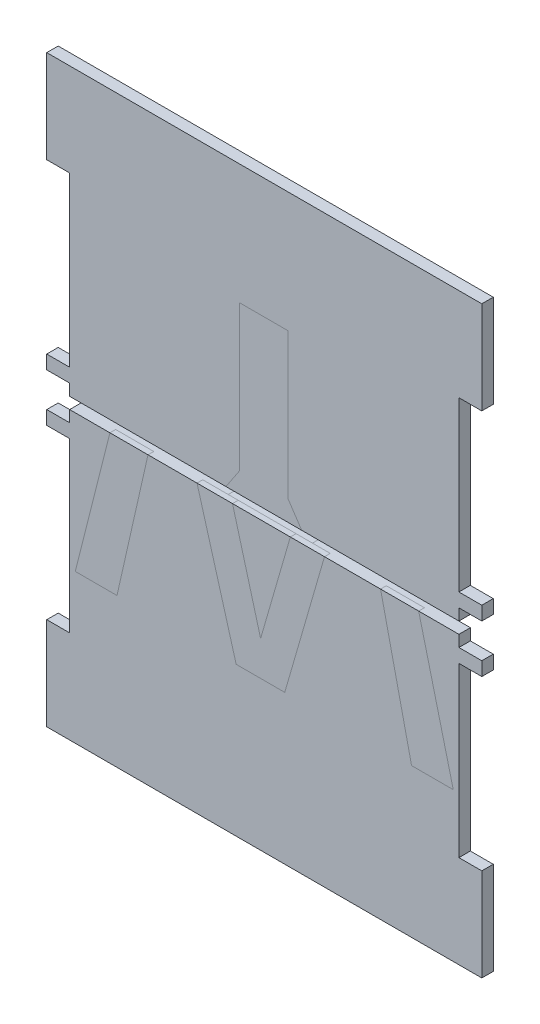
from build123d import *

# Parameters (mm, degrees)
FLIPS_DEPTH             = 1
FLIPS_2_DEPTH           = 1
FRONT_CUT_START         = -0.5
FRONT_CUT_DEPTH         = 0.5
FRONT_CUT_2_DEPTH       = 0.5
FRONT_EXTRUDE_START     = -0.5
FRONT_EXTRUDE_DEPTH     = 0.5
NEXT_CUT_DEPTH          = 0.5
NEXT_EXTRUDE_START      = 0.5
NEXT_EXTRUDE_DEPTH      = 0.5
CLEANUP_CUT_START       = 0.5
CLEANUP_CUT_DEPTH       = 0.5
CLEANUP_CUT_2_DEPTH     = 0.5
CLEANUP_CUT_START_2     = -15
CLEANUP_CUT_3_OUTLINE_W = 30
CLEANUP_CUT_3_OUTLINE_H = 0.5
CLEANUP_CUT_3_DEPTH     = 15.5
CLEANUP_CUT_START_3     = -0.5
CLEANUP_CUT_4_OUTLINE_W = 11
CLEANUP_CUT_4_OUTLINE_H = 0.5
CLEANUP_CUT_4_DEPTH     = 15.5
PREV_CUT_DEPTH          = 0.5
PREV_EXTRUDE_DEPTH      = 0.5
CLEANUP_CUT2_DEPTH      = 32.815876683
CLEANUP_CUT2_DEPTH_BACK = 32.815876683
FRONT_CHAR_5_OUTSIDE_W  = 52.722
FRONT_CHAR_5_OUTSIDE_H  = 65.722


with BuildPart() as part:
    # Front_Char → Flips (new body)
    with BuildSketch(Plane.XY):
        Polygon((19, 1.5), (19, 2.7), (17, 2.7), (17, 17.394721707), (19, 17.394721707), (19, 25.5), (-19, 25.5), (-19, 17.394721707), (-17, 17.394721707), (-17, 2.7), (-19, 2.7), (-19, 1.5), (-17, 1.5), (-17, 0.5), (17, 0.5), (17, 1.5), align=None)
    extrude(amount=FLIPS_DEPTH)

    # Front_Cut 2 outline → Front_Cut 2 (cut)
    with BuildSketch(Plane(origin=(0, 0, 0), x_dir=(-1, 0, 0), z_dir=(0, 0, -1)).offset(FRONT_CUT_START)):
        with BuildLine():
            add(Edge.make_bspline(
                [(-1.796875, 7.403846154), (-1.668358724, 7.213760088), (-1.427193674, 6.857057286), (-1.091948313, 6.351098385), (-0.81895366, 5.902065857), (-0.59073302, 5.516459789), (-0.424619237, 5.187987694), (-0.303286719, 4.92271251), (-0.241039558, 4.712483045), (-0.240571503, 4.591554361), (-0.240384615, 4.543269231)],
                knots=[0, 0, 0, 0, 0.209538372, 0.393205699, 0.554151123, 0.689381787, 0.802279615, 0.88995155, 0.956059195, 1, 1, 1, 1], degree=3))
            Line((-1.796875, 7.403846154), (-7.03125, 15))
            Line((-7.03125, 15), (-12.127403846, 15))
            Line((-12.127403846, 15), (-2.578125, 1.141826923))
            Line((-2.578125, 1.141826923), (-3.018992711, 0.5))
            Line((-3.018992711, 0.5), (2.963148805, 0.5))
            Line((2.963148805, 0.5), (2.554086538, 1.09375))
            Line((2.554086538, 1.09375), (12.103365385, 15))
            Line((12.103365385, 15), (6.935096154, 15))
            Line((6.935096154, 15), (1.71875, 7.397836538))
            add(Edge.make_bspline(
                [(-0.240384615, 4.543269231), (-0.112073047, 4.729494248), (0.169135601, 5.137626465), (0.622821442, 5.801402262), (1.147074806, 6.56702918), (1.520315923, 7.109455141), (1.71875, 7.397836538)],
                knots=[0, 0, 0, 0, 0.195959094, 0.429465498, 0.696674664, 1, 1, 1, 1], degree=3))
        make_face()
    extrude(amount=FRONT_CUT_2_DEPTH, mode=Mode.SUBTRACT)

    # Next_Char → Next_Cut (cut)
    with BuildSketch(Plane.XY.offset(1)):
        with BuildLine():
            Line((2.073317308, 15), (2.073317308, 2.289663462))
            Line((2.073317308, 2.289663462), (13.611778846, -15))
            Line((13.611778846, -15), (8.605769231, -15))
            Line((8.605769231, -15), (2.788461538, -5.829326923))
            add(Edge.make_bspline(
                [(2.788461538, -5.829326923), (2.527139066, -5.421248007), (2.020648394, -4.630316548), (1.29915823, -3.471049535), (0.601160811, -2.399532249), (0.163329239, -1.701315402), (-0.048076923, -1.364182692)],
                knots=[0, 0, 0, 0, 1.099235052, 2.130518266, 3.097324212, 4, 4, 4, 4], degree=3))
            add(Edge.make_bspline(
                [(-0.048076923, -1.364182692), (-0.261127879, -1.696263627), (-0.715771827, -2.404913753), (-1.42586903, -3.545743348), (-2.242751863, -4.808410274), (-2.805506862, -5.702476855), (-3.100961538, -6.171875)],
                knots=[0, 0, 0, 0, 0.831333946, 1.774040134, 2.831338233, 4, 4, 4, 4], degree=3))
            Line((-3.100961538, -6.171875), (-8.689903846, -15))
            Line((-8.689903846, -15), (-13.695913462, -15))
            Line((-13.695913462, -15), (-2.157451923, 2.289663462))
            Line((-2.157451923, 2.289663462), (-2.157451923, 15))
            Line((-2.157451923, 15), (2.073317308, 15))
        make_face()
    extrude(amount=-NEXT_CUT_DEPTH, mode=Mode.SUBTRACT)


with BuildPart() as body_2:
    # Front_Char → Flips 2 (new body)
    with BuildSketch(Plane.XY):
        Polygon((17, -0.5), (17, -1.5), (19, -1.5), (19, -2.7), (17, -2.7), (17, -17.394721707), (19, -17.394721707), (19, -25.5), (-19, -25.5), (-19, -17.394721707), (-17, -17.394721707), (-17, -2.7), (-19, -2.7), (-19, -1.5), (-17, -1.5), (-17, -0.5), align=None)
    extrude(amount=FLIPS_2_DEPTH)

    # Front_Cut: read off the stored shape, not the designer's step
    # Front_Cut outline → Front_Cut (cut)
    with BuildSketch(Plane(origin=(0, 0, 0), x_dir=(-1, 0, 0), z_dir=(0, 0, -1)).offset(FRONT_CUT_START)):
        with BuildLine():
            add(Edge.make_bspline(
                [(1.237980769, -4.399038462), (1.02932484, -4.098780348), (0.616783507, -3.505128955), (0.20802532, -2.908866437), (0.006009615, -2.614182692)],
                knots=[0, 0, 0, 0, 0.505781874, 1, 1, 1, 1], degree=3))
            Line((1.237980769, -4.399038462), (8.539663462, -15))
            Line((8.539663462, -15), (13.641826923, -15))
            Line((13.641826923, -15), (3.65209578, -0.5))
            Line((3.65209578, -0.5), (-3.705887723, -0.5))
            Line((-3.705887723, -0.5), (-13.665865385, -15))
            Line((-13.665865385, -15), (-8.503605769, -15))
            Line((-8.503605769, -15), (-1.40625, -4.675480769))
            add(Edge.make_bspline(
                [(0.006009615, -2.614182692), (-0.147818769, -2.838828558), (-0.43099404, -3.252368321), (-0.825162113, -3.815479877), (-1.1362099, -4.281944613), (-1.323884664, -4.555447717), (-1.40625, -4.675480769)],
                knots=[0, 0, 0, 0, 0.326889026, 0.601754279, 0.825220815, 1, 1, 1, 1], degree=3))
        make_face()
    extrude(amount=FRONT_CUT_DEPTH, mode=Mode.SUBTRACT)

    # Prev_Char → Prev_Cut (cut)
    with BuildSketch(Plane.XY.offset(1)):
        with BuildLine():
            Line((10.211338141, 12.5), (16.506410256, -12.5))
            Line((16.506410256, -12.5), (12.865584936, -12.5))
            Line((12.865584936, -12.5), (9.154647436, 3.94130609))
            add(Edge.make_bspline(
                [(9.154647436, 3.94130609), (8.962323574, 4.789250655), (8.579639319, 6.476482969), (8.201112736, 8.1646529), (8.012820513, 9.004407051)],
                knots=[0, 0, 0, 0, 1.00513078, 2, 2, 2, 2], degree=3))
            add(Edge.make_bspline(
                [(8.012820513, 9.004407051), (7.923670053, 8.702452242), (7.75537023, 8.132416585), (7.527861486, 7.324336111), (7.321222583, 6.619065942), (7.145176842, 6.013318214), (7.002633286, 5.506241888), (6.8795628, 5.104067894), (6.795679493, 4.79892035), (6.745970094, 4.630691497), (6.725761218, 4.562299679)],
                knots=[0, 0, 0, 0, 1.633809233, 3.084334118, 4.356383392, 5.447555203, 6.357852567, 7.089694452, 7.629924063, 8, 8, 8, 8], degree=3))
            Line((6.725761218, 4.562299679), (1.787860577, -12.5))
            Line((1.787860577, -12.5), (-2.453926282, -12.5))
            Line((-2.453926282, -12.5), (-6.024639423, 0.025040064))
            add(Edge.make_bspline(
                [(-6.024639423, 0.025040064), (-6.221693067, 0.798787916), (-6.610240205, 2.324451225), (-7.126487791, 4.596983239), (-7.602967814, 6.814383167), (-7.877429254, 8.280951792), (-8.012820513, 9.004407051)],
                knots=[0, 0, 0, 0, 1.04154457, 2.053700482, 3.039894486, 4, 4, 4, 4], degree=3))
            add(Edge.make_bspline(
                [(-8.012820513, 9.004407051), (-8.096609752, 8.63555597), (-8.273613413, 7.856362934), (-8.545813732, 6.62662536), (-8.8547496, 5.277284142), (-9.064942079, 4.337038053), (-9.174679487, 3.846153846)],
                knots=[0, 0, 0, 0, 0.858436457, 1.813435672, 2.858437265, 4, 4, 4, 4], degree=3))
            Line((-9.174679487, 3.846153846), (-12.865584936, -12.5))
            Line((-12.865584936, -12.5), (-16.506410256, -12.5))
            Line((-16.506410256, -12.5), (-10.206330128, 12.5))
            Line((-10.206330128, 12.5), (-6.330128205, 12.5))
            Line((-6.330128205, 12.5), (-1.106770833, -6.60556891))
            add(Edge.make_bspline(
                [(-1.106770833, -6.60556891), (-1.054320801, -6.792343603), (-0.954685271, -7.14714597), (-0.824086426, -7.653460973), (-0.694575493, -8.098744187), (-0.591562317, -8.488750166), (-0.502413038, -8.819548863), (-0.423467538, -9.090171754), (-0.372691915, -9.305915362), (-0.335973343, -9.428537611), (-0.320512821, -9.480168269)],
                knots=[0, 0, 0, 0, 1.562239628, 2.967673567, 4.210417925, 5.296319877, 6.215971374, 6.969386481, 7.566055473, 8, 8, 8, 8], degree=3))
            add(Edge.make_bspline(
                [(-0.320512821, -9.480168269), (-0.227569577, -9.152822274), (-0.051514878, -8.532757829), (0.204879934, -7.660944314), (0.425315183, -6.895927635), (0.562495622, -6.423590497), (0.626001603, -6.204927885)],
                knots=[0, 0, 0, 0, 1.197732026, 2.268764715, 3.198546125, 4, 4, 4, 4], degree=3))
            Line((0.626001603, -6.204927885), (6.039663462, 12.5))
            Line((6.039663462, 12.5), (10.211338141, 12.5))
        make_face()
    extrude(amount=-PREV_CUT_DEPTH, mode=Mode.SUBTRACT)


with BuildPart() as body_3:
    # Front_Extrude: read off the stored shape, not the designer's step
    # Front_Extrude outline → Front_Extrude (new body)
    with BuildSketch(Plane(origin=(0, 0, 0), x_dir=(-1, 0, 0), z_dir=(0, 0, -1)).offset(FRONT_EXTRUDE_START)):
        with BuildLine():
            Line((-13.665865385, -15), (-8.503605769, -15))
            Line((-8.503605769, -15), (-1.40625, -4.675480769))
            add(Edge.make_bspline(
                [(0.006009615, -2.614182692), (-0.147818769, -2.838828558), (-0.43099404, -3.252368321), (-0.825162113, -3.815479877), (-1.1362099, -4.281944613), (-1.323884664, -4.555447717), (-1.40625, -4.675480769)],
                knots=[0, 0, 0, 0, 0.326889026, 0.601754279, 0.825220815, 1, 1, 1, 1], degree=3))
            add(Edge.make_bspline(
                [(1.237980769, -4.399038462), (1.02932484, -4.098780348), (0.616783507, -3.505128955), (0.20802532, -2.908866437), (0.006009615, -2.614182692)],
                knots=[0, 0, 0, 0, 0.505781874, 1, 1, 1, 1], degree=3))
            Line((1.237980769, -4.399038462), (8.539663462, -15))
            Line((8.539663462, -15), (13.641826923, -15))
            Line((13.641826923, -15), (2.554086538, 1.09375))
            Line((2.554086538, 1.09375), (12.103365385, 15))
            Line((12.103365385, 15), (6.935096154, 15))
            Line((6.935096154, 15), (1.71875, 7.397836538))
            add(Edge.make_bspline(
                [(-0.240384615, 4.543269231), (-0.112073047, 4.729494248), (0.169135601, 5.137626465), (0.622821442, 5.801402262), (1.147074806, 6.56702918), (1.520315923, 7.109455141), (1.71875, 7.397836538)],
                knots=[0, 0, 0, 0, 0.195959094, 0.429465498, 0.696674664, 1, 1, 1, 1], degree=3))
            add(Edge.make_bspline(
                [(-1.796875, 7.403846154), (-1.668358724, 7.213760088), (-1.427193674, 6.857057286), (-1.091948313, 6.351098385), (-0.81895366, 5.902065857), (-0.59073302, 5.516459789), (-0.424619237, 5.187987694), (-0.303286719, 4.92271251), (-0.241039558, 4.712483045), (-0.240571503, 4.591554361), (-0.240384615, 4.543269231)],
                knots=[0, 0, 0, 0, 0.209538372, 0.393205699, 0.554151123, 0.689381787, 0.802279615, 0.88995155, 0.956059195, 1, 1, 1, 1], degree=3))
            Line((-1.796875, 7.403846154), (-7.03125, 15))
            Line((-7.03125, 15), (-12.127403846, 15))
            Line((-12.127403846, 15), (-2.578125, 1.141826923))
            Line((-2.578125, 1.141826923), (-13.665865385, -15))
        make_face()
    extrude(amount=FRONT_EXTRUDE_DEPTH)

    # CleanUp_Cut 3 outline → CleanUp_Cut 3 (cut)
    with BuildSketch(Plane(origin=(0, 0, 0), x_dir=(1, 0, 0), z_dir=(0, 1, 0)).offset(CLEANUP_CUT_START_2)):
        with Locations((0, -0.25)):
            Rectangle(CLEANUP_CUT_3_OUTLINE_W, CLEANUP_CUT_3_OUTLINE_H)
    extrude(amount=CLEANUP_CUT_3_DEPTH, mode=Mode.SUBTRACT)


with BuildPart() as body_4:
    # Next_Extrude: read off the stored shape, not the designer's step
    # Next_Extrude outline → Next_Extrude (new body)
    with BuildSketch(Plane.XY.offset(NEXT_EXTRUDE_START)):
        with BuildLine():
            Line((2.073317308, 15), (-2.157451923, 15))
            Line((-2.157451923, 15), (-2.157451923, 2.289663462))
            Line((-2.157451923, 2.289663462), (-13.695913462, -15))
            Line((-13.695913462, -15), (-8.689903846, -15))
            Line((-8.689903846, -15), (-3.100961538, -6.171875))
            add(Edge.make_bspline(
                [(-0.048076923, -1.364182692), (-0.261127879, -1.696263627), (-0.715771827, -2.404913753), (-1.42586903, -3.545743348), (-2.242751863, -4.808410274), (-2.805506862, -5.702476855), (-3.100961538, -6.171875)],
                knots=[0, 0, 0, 0, 0.207833486, 0.443510033, 0.707834558, 1, 1, 1, 1], degree=3))
            add(Edge.make_bspline(
                [(2.788461538, -5.829326923), (2.527139066, -5.421248007), (2.020648394, -4.630316548), (1.29915823, -3.471049535), (0.601160811, -2.399532249), (0.163329239, -1.701315402), (-0.048076923, -1.364182692)],
                knots=[0, 0, 0, 0, 0.274808763, 0.532629567, 0.774331053, 1, 1, 1, 1], degree=3))
            Line((2.788461538, -5.829326923), (8.605769231, -15))
            Line((8.605769231, -15), (13.611778846, -15))
            Line((13.611778846, -15), (2.073317308, 2.289663462))
            Line((2.073317308, 2.289663462), (2.073317308, 15))
        make_face()
    extrude(amount=NEXT_EXTRUDE_DEPTH)

    # CleanUp_Cut 4 outline → CleanUp_Cut 4 (cut)
    with BuildSketch(Plane(origin=(0, 0, 0), x_dir=(1, 0, 0), z_dir=(0, 1, 0)).offset(CLEANUP_CUT_START_3)):
        with Locations((-0.5, -0.75)):
            Rectangle(CLEANUP_CUT_4_OUTLINE_W, CLEANUP_CUT_4_OUTLINE_H)
    extrude(amount=CLEANUP_CUT_4_DEPTH, mode=Mode.SUBTRACT)


with BuildPart() as body_5:
    # CleanUp_Cut: read off the stored shape, not the designer's step
    # CleanUp_Cut outline → CleanUp_Cut (new body)
    with BuildSketch(Plane.XY.offset(CLEANUP_CUT_START)):
        Polygon((3.2676704, 0.5), (2.073317308, 2.289663462), (2.073317308, 15), (-2.157451923, 15), (-2.157451923, 2.289663462), (-3.351805015, 0.5), align=None)
    extrude(amount=CLEANUP_CUT_DEPTH)


with BuildPart() as body_6:
    # CleanUp_Cut 2 outline → CleanUp_Cut 2 (new body)
    with BuildSketch(Plane.XY):
        with BuildLine():
            Line((8.503605769, -15), (13.665865385, -15))
            Line((13.665865385, -15), (3.705887723, -0.5))
            Line((3.705887723, -0.5), (-3.65209578, -0.5))
            Line((-3.65209578, -0.5), (-13.641826923, -15))
            Line((-13.641826923, -15), (-8.539663462, -15))
            Line((-8.539663462, -15), (-1.237980769, -4.399038462))
            add(Edge.make_bspline(
                [(-1.237980769, -4.399038462), (-1.02932484, -4.098780348), (-0.616783507, -3.505128955), (-0.20802532, -2.908866437), (-0.006009615, -2.614182692)],
                knots=[0, 0, 0, 0, 0.505781874, 1, 1, 1, 1], degree=3))
            add(Edge.make_bspline(
                [(-0.006009615, -2.614182692), (0.147818769, -2.838828558), (0.43099404, -3.252368321), (0.825162113, -3.815479877), (1.1362099, -4.281944613), (1.323884664, -4.555447717), (1.40625, -4.675480769)],
                knots=[0, 0, 0, 0, 0.326889026, 0.601754279, 0.825220815, 1, 1, 1, 1], degree=3))
            Line((1.40625, -4.675480769), (8.503605769, -15))
        make_face()
    extrude(amount=CLEANUP_CUT_2_DEPTH)


with BuildPart() as body_6_2:
    # Prev_Char<2> → Prev_Extrude (new body)
    with BuildSketch(Plane.XY.offset(1)):
        with BuildLine():
            Line((10.211338141, 12.5), (16.506410256, -12.5))
            Line((16.506410256, -12.5), (12.865584936, -12.5))
            Line((12.865584936, -12.5), (9.154647436, 3.94130609))
            add(Edge.make_bspline(
                [(9.154647436, 3.94130609), (8.962323574, 4.789250655), (8.579639319, 6.476482969), (8.201112736, 8.1646529), (8.012820513, 9.004407051)],
                knots=[0, 0, 0, 0, 1.00513078, 2, 2, 2, 2], degree=3))
            add(Edge.make_bspline(
                [(8.012820513, 9.004407051), (7.923670053, 8.702452242), (7.75537023, 8.132416585), (7.527861486, 7.324336111), (7.321222583, 6.619065942), (7.145176842, 6.013318214), (7.002633286, 5.506241888), (6.8795628, 5.104067894), (6.795679493, 4.79892035), (6.745970094, 4.630691497), (6.725761218, 4.562299679)],
                knots=[0, 0, 0, 0, 1.633809233, 3.084334118, 4.356383392, 5.447555203, 6.357852567, 7.089694452, 7.629924063, 8, 8, 8, 8], degree=3))
            Line((6.725761218, 4.562299679), (1.787860577, -12.5))
            Line((1.787860577, -12.5), (-2.453926282, -12.5))
            Line((-2.453926282, -12.5), (-6.024639423, 0.025040064))
            add(Edge.make_bspline(
                [(-6.024639423, 0.025040064), (-6.221693067, 0.798787916), (-6.610240205, 2.324451225), (-7.126487791, 4.596983239), (-7.602967814, 6.814383167), (-7.877429254, 8.280951792), (-8.012820513, 9.004407051)],
                knots=[0, 0, 0, 0, 1.04154457, 2.053700482, 3.039894486, 4, 4, 4, 4], degree=3))
            add(Edge.make_bspline(
                [(-8.012820513, 9.004407051), (-8.096609752, 8.63555597), (-8.273613413, 7.856362934), (-8.545813732, 6.62662536), (-8.8547496, 5.277284142), (-9.064942079, 4.337038053), (-9.174679487, 3.846153846)],
                knots=[0, 0, 0, 0, 0.858436457, 1.813435672, 2.858437265, 4, 4, 4, 4], degree=3))
            Line((-9.174679487, 3.846153846), (-12.865584936, -12.5))
            Line((-12.865584936, -12.5), (-16.506410256, -12.5))
            Line((-16.506410256, -12.5), (-10.206330128, 12.5))
            Line((-10.206330128, 12.5), (-6.330128205, 12.5))
            Line((-6.330128205, 12.5), (-1.106770833, -6.60556891))
            add(Edge.make_bspline(
                [(-1.106770833, -6.60556891), (-1.054320801, -6.792343603), (-0.954685271, -7.14714597), (-0.824086426, -7.653460973), (-0.694575493, -8.098744187), (-0.591562317, -8.488750166), (-0.502413038, -8.819548863), (-0.423467538, -9.090171754), (-0.372691915, -9.305915362), (-0.335973343, -9.428537611), (-0.320512821, -9.480168269)],
                knots=[0, 0, 0, 0, 1.562239628, 2.967673567, 4.210417925, 5.296319877, 6.215971374, 6.969386481, 7.566055473, 8, 8, 8, 8], degree=3))
            add(Edge.make_bspline(
                [(-0.320512821, -9.480168269), (-0.227569577, -9.152822274), (-0.051514878, -8.532757829), (0.204879934, -7.660944314), (0.425315183, -6.895927635), (0.562495622, -6.423590497), (0.626001603, -6.204927885)],
                knots=[0, 0, 0, 0, 1.197732026, 2.268764715, 3.198546125, 4, 4, 4, 4], degree=3))
            Line((0.626001603, -6.204927885), (6.039663462, 12.5))
            Line((6.039663462, 12.5), (10.211338141, 12.5))
        make_face()
    extrude(amount=-PREV_EXTRUDE_DEPTH)

    # Front_Char<5> outside → CleanUp_Cut2 (cut, two sides: drawn at the far end of the back side and taken through both)
    with BuildSketch(Plane.XY.offset(-CLEANUP_CUT2_DEPTH_BACK)):
        Rectangle(FRONT_CHAR_5_OUTSIDE_W, FRONT_CHAR_5_OUTSIDE_H)
        Polygon((19, 1.5), (19, 2.7), (17, 2.7), (17, 17.394721707), (19, 17.394721707), (19, 25.5), (-19, 25.5), (-19, 17.394721707), (-17, 17.394721707), (-17, 2.7), (-19, 2.7), (-19, 1.5), (-17, 1.5), (-17, 0.5), (17, 0.5), (17, 1.5), align=None, mode=Mode.SUBTRACT)
        Polygon((17, -0.5), (17, -1.5), (19, -1.5), (19, -2.7), (17, -2.7), (17, -17.394721707), (19, -17.394721707), (19, -25.5), (-19, -25.5), (-19, -17.394721707), (-17, -17.394721707), (-17, -2.7), (-19, -2.7), (-19, -1.5), (-17, -1.5), (-17, -0.5), align=None, mode=Mode.SUBTRACT)
    extrude(amount=CLEANUP_CUT2_DEPTH + CLEANUP_CUT2_DEPTH_BACK, mode=Mode.SUBTRACT)


with BuildPart() as cleanup_cut2_piece_1:
    # of the separate pieces the step leaves, piece 1, a body of its own (cleanup_cut2_pieces)
    add(body_6_2.part.solids().sort_by_distance((10.211338141, 12.5, 1))[0])


with BuildPart() as cleanup_cut2_piece_2:
    # of the separate pieces the step leaves, piece 2, a body of its own (cleanup_cut2_pieces)
    add(body_6_2.part.solids().sort_by_distance((0.626001603, -6.204927885, 1))[0])


with BuildPart() as cleanup_cut2_piece_3:
    # of the separate pieces the step leaves, piece 3, a body of its own (cleanup_cut2_pieces)
    add(body_6_2.part.solids().sort_by_distance((-6.330128205, 12.5, 1))[0])


with BuildPart() as cleanup_cut2_piece_4:
    # of the separate pieces the step leaves, piece 4, a body of its own (cleanup_cut2_pieces)
    add(body_6_2.part.solids().sort_by_distance((13.484775641, -0.5, 1))[0])


with BuildPart() as cleanup_cut2_piece_5:
    # of the separate pieces the step leaves, piece 5, a body of its own (cleanup_cut2_pieces)
    add(body_6_2.part.solids().sort_by_distance((-16.506410256, -12.5, 1))[0])


solid = Compound([part.part, body_2.part, body_3.part, body_5.part, body_6.part, cleanup_cut2_piece_2.part, cleanup_cut2_piece_4.part, cleanup_cut2_piece_5.part])
